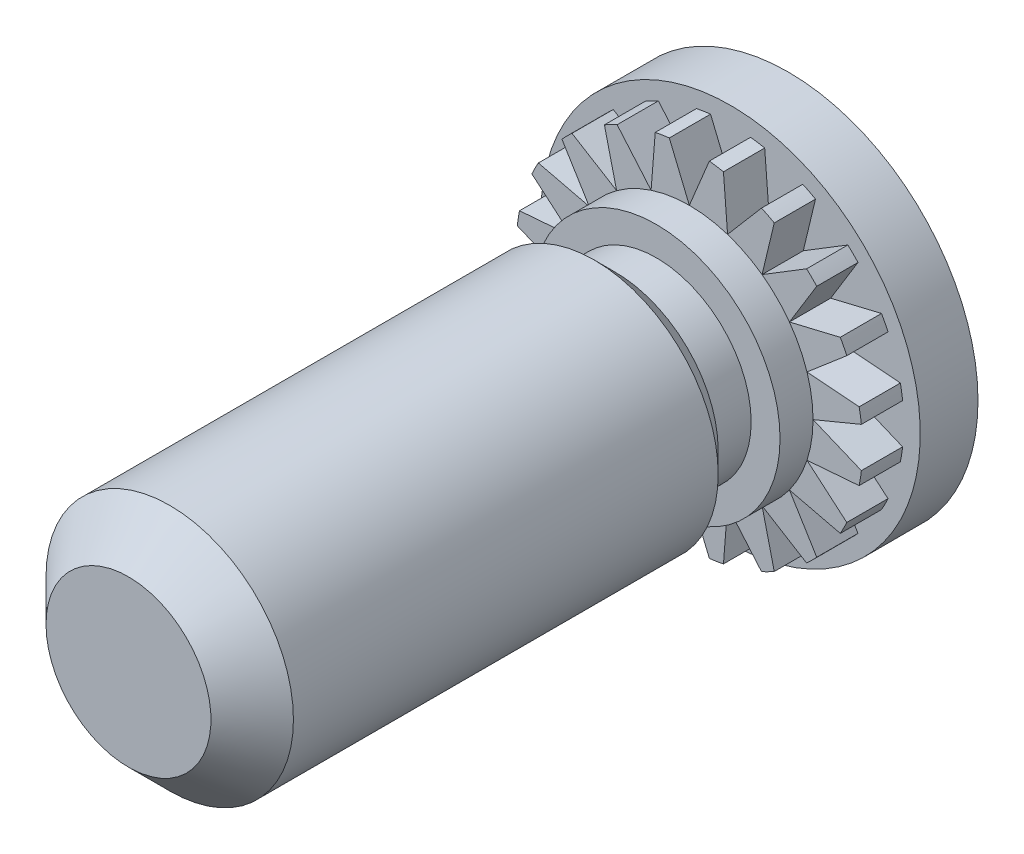
from build123d import *

# Parameters (mm, degrees)
SKETCH_1_R               = 2.3
EXTRUDE_1_DEPTH          = 1.2
SKETCH_2_R               = 1.5
EXTRUDE_2_DEPTH          = 1.5
CUT_EXTRUDE_1_DEPTH      = 0.5
PATTERN_CIRCULAR_1_COUNT = 20
SKETCH_4_W               = 0.35
SKETCH_4_H               = 0.5
SKETCH_6_W               = 5.3
SKETCH_6_H               = 1.5
CHAMFER_2_SIZE           = 0.5
CUT_EXTRUDE_START        = -0.5
SKETCH_7_R               = 2.3
SKETCH_7_R_2             = 2.1
CUT_EXTRUDE_2_DEPTH      = 0.5


with BuildPart() as part:
    # Эскиз1 → Вытянуть1 (new body)
    with BuildSketch(Plane.XY):
        Circle(SKETCH_1_R)
    extrude(amount=EXTRUDE_1_DEPTH)

    # Эскиз2 → Вытянуть2 (add)
    with BuildSketch(Plane.XY.offset(1.2)):
        Circle(SKETCH_2_R)
    extrude(amount=EXTRUDE_2_DEPTH)

    # Эскиз3 → Вырез-Вытянуть1 (cut)
    with BuildSketch(Plane.XY.offset(1.2)):
        Polygon((-0.33137085, 2.3), (0.33137085, 2.3), (0, 1.5), align=None)
    cut_extrude_1 = extrude(amount=-CUT_EXTRUDE_1_DEPTH, mode=Mode.SUBTRACT)

    # Круговой массив1: Вырез-Вытянуть1 ×20 about axis
    pattern_circular_1_axis = Axis((0, 0, 0), (0, 0, 1))
    for i in range(1, PATTERN_CIRCULAR_1_COUNT):
        add(cut_extrude_1.rotate(pattern_circular_1_axis, i * 360 / PATTERN_CIRCULAR_1_COUNT), mode=Mode.SUBTRACT)

    # Эскиз4 → Вырез-Повернуть1 (revolve, cut)
    with BuildSketch(Plane(origin=(0, 0, 0), x_dir=(1, 0, 0), z_dir=(0, 1, 0))):
        with Locations((1.325, -1.85)):
            Rectangle(SKETCH_4_W, SKETCH_4_H)
    revolve(axis=Axis((0, 0, 10.642619983), (0, 0, -1)), mode=Mode.SUBTRACT)

    # Эскиз6 → Повернуть1 (revolve)
    with BuildSketch(Plane(origin=(0, 0, 0), x_dir=(0, 0, -1), z_dir=(1, 0, 0)), mode=Mode.PRIVATE) as revolve_1_sk:
        with Locations((-5.35, -0.75)):
            Rectangle(SKETCH_6_W, SKETCH_6_H)
    revolve(revolve_1_sk.sketch.rotate(Axis((0, 0, 2.7), (0, 0, 1)), 278.047567557), axis=Axis((0, 0, 2.7), (0, 0, 1)))

    # Фаска2
    # the kernel refuses this chamfer: 0.5 mm, written as the material it takes off along each edge
    with BuildSketch(Plane(origin=(0, 0, 8), x_dir=(-0.9901521845161062, -0.1399951838385265, 0), z_dir=(-0.1399951838385265, 0.9901521845161062, 0))) as chamfer_2_piece_1:
        Polygon((1.5, -CHAMFER_2_SIZE), (1.5 - CHAMFER_2_SIZE, 0), (1.5, 0), align=None)
    revolve(axis=Axis((0, 0, 8), (0, 0, 1)), mode=Mode.SUBTRACT)

    # Эскиз7 → Вырез-Вытянуть2 (cut)
    with BuildSketch(Plane.XY.offset(1.2).offset(CUT_EXTRUDE_START)):
        with Locations(Location((0, 0, 0), (0, 0, 180))):
            Circle(SKETCH_7_R)
        Circle(SKETCH_7_R_2, mode=Mode.SUBTRACT)
    extrude(amount=CUT_EXTRUDE_2_DEPTH, mode=Mode.SUBTRACT)

    # Фаска3
    # the kernel refuses this chamfer: 0.25 mm, written as the material it takes off along each edge
    with BuildSketch(Plane(origin=(0, 0, 2.1), x_dir=(1, 0, 0), z_dir=(0, 1, 0))) as chamfer_3_piece_1:
        with BuildLine():
            Line((1.242928932, 0.007071068), (1.507071068, -0.257071068))
            Line((1.507071068, -0.257071068), (1.512071068, -0.257071068))
            ThreePointArc((1.512071068, -0.257071068), (1.505, -0.128535534), (1.505, 0))
            Line((1.505, 0), (1.5, 0.005))
            ThreePointArc((1.5, 0.005), (1.371464466, 0.005), (1.242928932, 0.012071068))
            Line((1.242928932, 0.012071068), (1.242928932, 0.007071068))
        make_face()
    revolve(axis=Axis((0, 0, 2.1), (0, 0, -1)), mode=Mode.SUBTRACT)


solid = part.part
